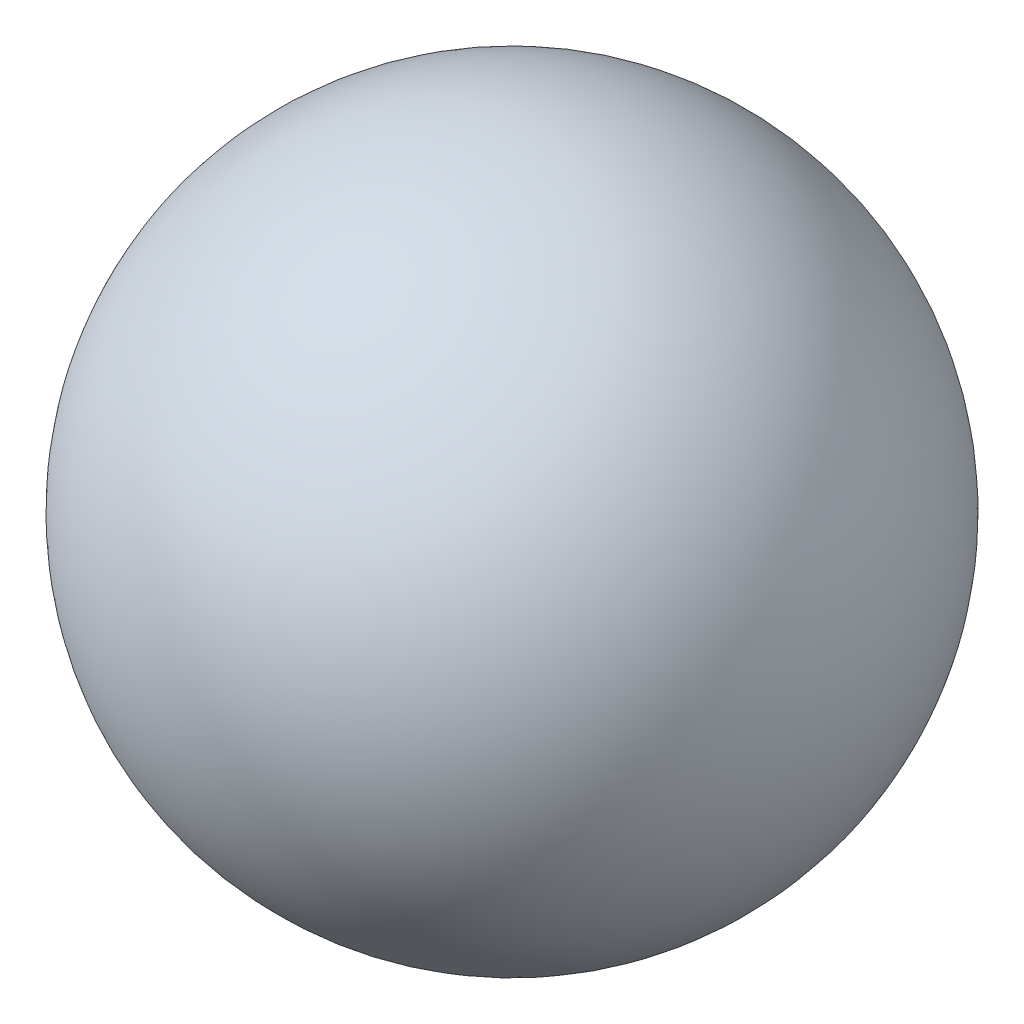
from build123d import *


with BuildPart() as part:
    # Sketch1 → Revolve1 (revolve)
    with BuildSketch(Plane(origin=(0, 0, 0), x_dir=(1, 0, 0), z_dir=(0, 1, 0))):
        with BuildLine():
            Line((-27.624674687, 0), (27.624674687, 0))
            ThreePointArc((27.624674687, 0), (0, 27.624674687), (-27.624674687, 0))
        make_face()
    revolve(axis=Axis((-27.624674687, 0, 0), (1, 0, 0)))


solid = part.part
